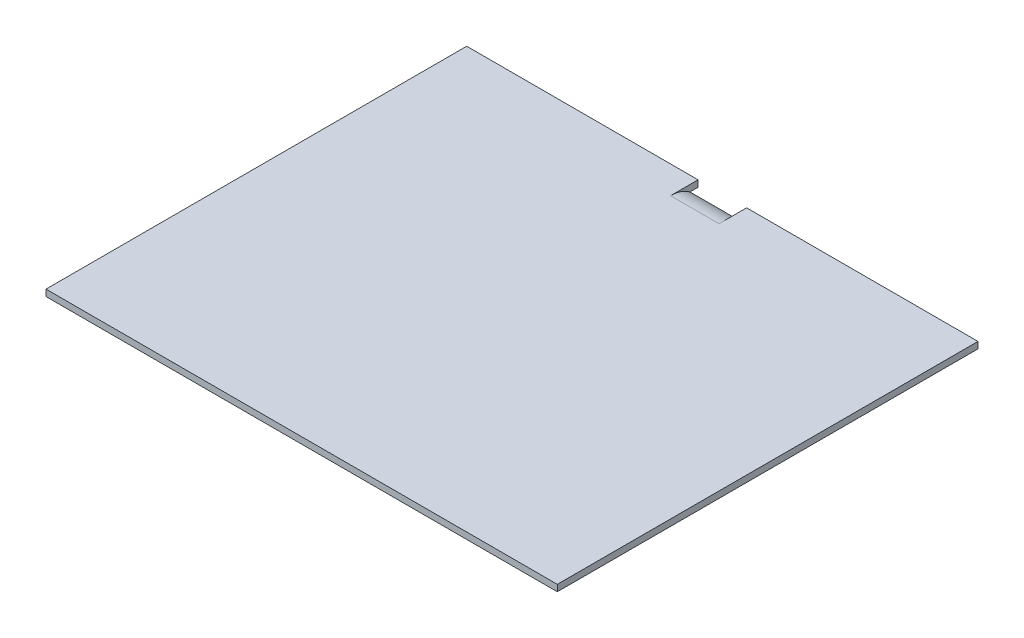
from build123d import *

# Parameters (mm, degrees)
ESQUISSE1_W             = 79
ESQUISSE1_H             = 65
BOSS_EXTRU_1_DEPTH      = 1
ESQUISSE3_W             = 7.5
ESQUISSE3_H             = 7.5
ENL_V_MAT_EXTRU_1_DEPTH = 1.25
CONG_1_R                = 5


with BuildPart() as part:
    # Esquisse1 → Boss.-Extru.1 (new body)
    with BuildSketch(Plane(origin=(0, 0, 0), x_dir=(1, 0, 0), z_dir=(0, 1, 0))):
        Rectangle(ESQUISSE1_W, ESQUISSE1_H)
    extrude(amount=BOSS_EXTRU_1_DEPTH)

    # Esquisse3 → Enlèv. mat.-Extru.1 (cut)
    with BuildSketch(Plane(origin=(0, 0, -32.5), x_dir=(-1, 0, 0), z_dir=(0, 0, -1))):
        with Locations((0, 0.5)):
            Rectangle(ESQUISSE3_W, ESQUISSE3_H)
    extrude(amount=-ENL_V_MAT_EXTRU_1_DEPTH, mode=Mode.SUBTRACT)

    # Congé1
    # the kernel refuses this fillet: 5 mm, written as the material it takes off along each edge
    with BuildSketch(Plane(origin=(3.75, 1, -31.25), x_dir=(0, 0, 1), z_dir=(-1, 0, 0))) as cong_1_piece_1:
        with BuildLine():
            CenterArc((3, -5), CONG_1_R, 90, 36.869897646)
            Line((0, -1), (-0.06, -0.92))
            ThreePointArc((-0.06, -0.92), (-0.1, -0.5), (-0.1, 0))
            Line((-0.1, 0), (0, 0.1))
            Line((0, 0.1), (3, 0.1))
            Line((3, 0.1), (3, 0))
        make_face()
    extrude(amount=7.5, mode=Mode.SUBTRACT)


solid = part.part
